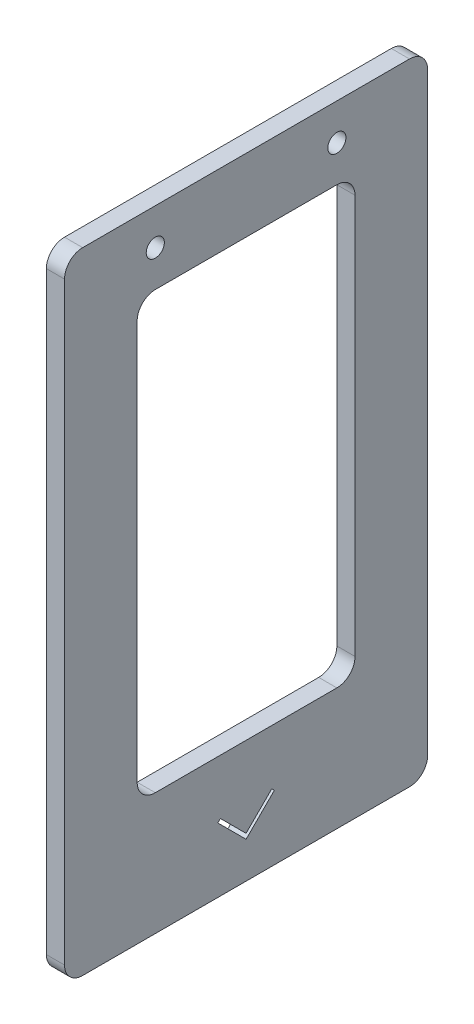
from build123d import *

# Parameters (mm, degrees)
BOSS_EXTRUDE2_DEPTH     = 6.35
CUT_EXTRUDE1_REACH      = 129.376
CUT_EXTRUDE2_DEPTH      = 128.37561853
CUT_EXTRUDE2_DEPTH_BACK = 128.37561853
SKETCH5_R               = 3.175


with BuildPart() as part:
    # Sketch3 → Boss-Extrude2 (new body)
    with BuildSketch(Plane(origin=(0, 0, 0), x_dir=(0, 0, -1), z_dir=(1, 0, 0))):
        with BuildLine():
            Line((-57.15, -110.236), (57.15, -110.236))
            ThreePointArc((57.15, -110.236), (61.640128061, -108.376128061), (63.5, -103.886))
            Line((63.5, -103.886), (63.5, 103.886))
            ThreePointArc((63.5, 103.886), (61.640128061, 108.376128061), (57.15, 110.236))
            Line((57.15, 110.236), (-57.15, 110.236))
            ThreePointArc((-57.15, 110.236), (-61.640128061, 108.376128061), (-63.5, 103.886))
            Line((-63.5, 103.886), (-63.5, -103.886))
            ThreePointArc((-63.5, -103.886), (-61.640128061, -108.376128061), (-57.15, -110.236))
        make_face()
        with BuildLine():
            Line((-31.75, -67.564), (31.75, -67.564))
            ThreePointArc((31.75, -67.564), (36.240128061, -65.704128061), (38.1, -61.214))
            Line((38.1, -61.214), (38.1, 78.486))
            ThreePointArc((38.1, 78.486), (36.240128061, 82.976128061), (31.75, 84.836))
            Line((31.75, 84.836), (-31.75, 84.836))
            ThreePointArc((-31.75, 84.836), (-36.240128061, 82.976128061), (-38.1, 78.486))
            Line((-38.1, 78.486), (-38.1, -61.214))
            ThreePointArc((-38.1, -61.214), (-36.240128061, -65.704128061), (-31.75, -67.564))
        make_face(mode=Mode.SUBTRACT)
    extrude(amount=BOSS_EXTRUDE2_DEPTH)

    # Sketch4 → Cut-Extrude1 (cut, up to next)
    with BuildSketch(Plane(origin=(6.35, 0, 0), x_dir=(0, 0, -1), z_dir=(1, 0, 0)), mode=Mode.PRIVATE) as cut_extrude1_sk1:
        Polygon((0, -95.739948776), (-8.980256121, -86.759692655), (-9.878281733, -87.657718267), (0, -97.536), (9.878281733, -87.657718267), (8.980256121, -86.759692655), align=None)
    cut_extrude1_tool1 = extrude(cut_extrude1_sk1.sketch, amount=-CUT_EXTRUDE1_REACH, mode=Mode.PRIVATE) & part.part
    add(cut_extrude1_tool1.solids().sort_by_distance((6.35, -91.408951, 4.649259))[0], mode=Mode.SUBTRACT)

    # Sketch5 → Cut-Extrude2 (cut, two sides: drawn at the far end of the back side and taken through both)
    with BuildSketch(Plane(origin=(6.35, 0, 0), x_dir=(0, 0, -1), z_dir=(1, 0, 0)).offset(-CUT_EXTRUDE2_DEPTH_BACK)):
        with Locations((-31.75, 97.536)):
            Circle(SKETCH5_R)
        with Locations((31.75, 97.536)):
            Circle(SKETCH5_R)
    extrude(amount=CUT_EXTRUDE2_DEPTH + CUT_EXTRUDE2_DEPTH_BACK, mode=Mode.SUBTRACT)


solid = part.part
